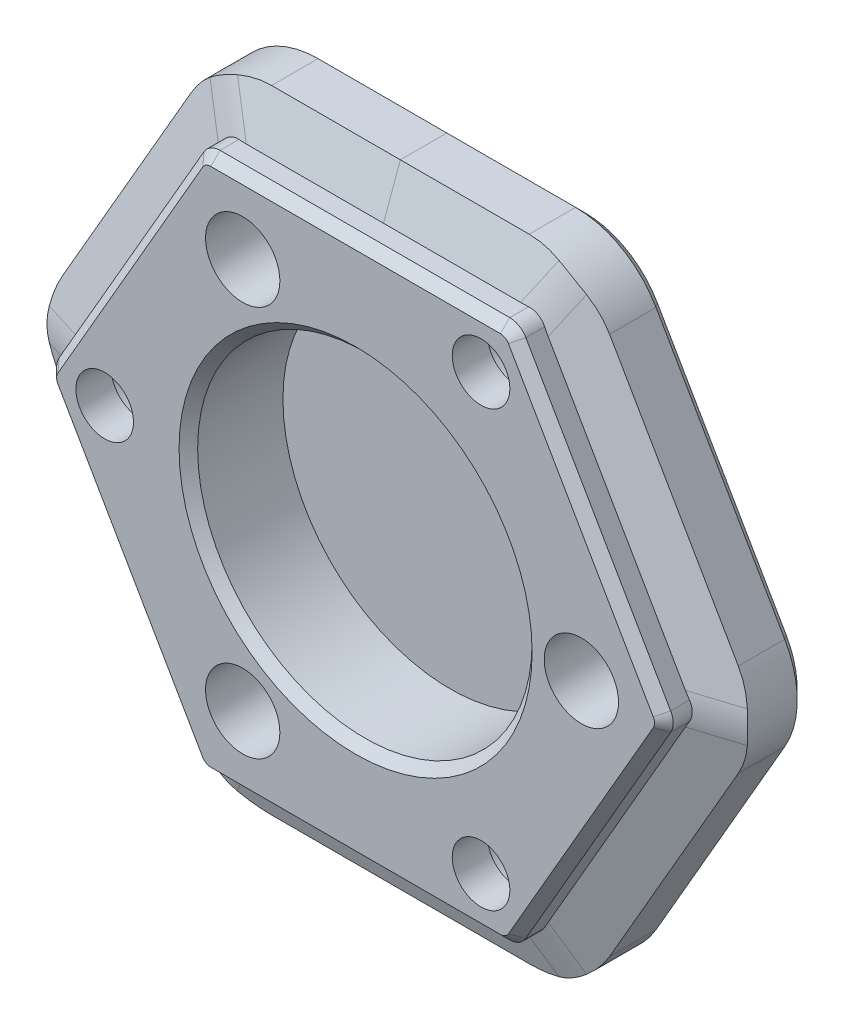
from build123d import *

# Parameters (mm, degrees)
EXTRUDE_1_DEPTH              = 2.5
EXTRUDE_1_DEPTH_BACK         = 5.5
HOLE_WIZARD_M3_1_D           = 3.1
HOLE_WIZARD_M3_1_CBORE_D     = 4.7
HOLE_WIZARD_M3_1_CBORE_DEPTH = 3.1
F_4_0MM_1_D                  = 4
F_4_0MM_1_DEPTH              = 3
F_4_0MM_1_TIP                = 1.2017212380551205
SKETCH_8_R                   = 9
CUT_EXTRUDE_1_DEPTH          = 24.549593060886075
FILLET_1_R                   = 5
FILLET_2_R                   = 1
CHAMFER_1_SIZE               = 0.5
SKETCH_12_W                  = 46.13133583021225
SKETCH_12_H                  = 41.62522244020373
CUT_EXTRUDE_2_DEPTH          = 2.90993
SKETCH_15_R                  = 2.3500000000000005
SKETCH_15_R_2                = 2.35
SKETCH_15_R_3                = 2.3499999999999965
EXTRUDE_2_DEPTH              = 0.31999999999999984
CUT_EXTRUDE_START            = -3
SKETCH_16_R                  = 2.35
SKETCH_16_R_2                = 2.3499999999999983
SKETCH_16_R_3                = 2.350000000000001
CUT_EXTRUDE_3_DEPTH          = 3
CHAMFER_3_SIZE               = 0.5


with BuildPart() as part:
    # 草图2 → 凸台-拉伸1 (new, two sides: drawn at the far end of the back side and taken through both)
    with BuildSketch(Plane.XY.offset(-EXTRUDE_1_DEPTH_BACK)):
        Polygon((8.37157890324957, 14.500000000000002), (-8.371578903249578, 14.5), (-16.743157806499145, -8.65e-15), (-8.371578903249565, -14.500000000000005), (8.37157890324958, -14.500000000000002), (16.743157806499152, 4.1e-15), align=None)
    extrude(amount=EXTRUDE_1_DEPTH + EXTRUDE_1_DEPTH_BACK)

    # M3 六角圆柱头螺钉的柱形沉头孔1 (through all)
    with Locations(Plane(origin=(0, 0, -5.5), x_dir=(-1, 0, 0), z_dir=(0, 0, -1))):
        with Locations((-6.75, 11.691342951), (13.5, 0), (-6.75, -11.691342951)):
            CounterBoreHole(HOLE_WIZARD_M3_1_D / 2, HOLE_WIZARD_M3_1_CBORE_D / 2, HOLE_WIZARD_M3_1_CBORE_DEPTH)

    # Ø4.0mm 暗销孔1
    with Locations(Plane.XY.offset(2.5)):
        with Locations((-6.075, 10.522208656), (12.15, 0), (-6.075, -10.522208656)):
            Hole(F_4_0MM_1_D / 2, depth=F_4_0MM_1_DEPTH)
            with Locations((0, 0, -(F_4_0MM_1_DEPTH + F_4_0MM_1_TIP / 2))):  # 118° drill point
                Cone(0, F_4_0MM_1_D / 2, F_4_0MM_1_TIP, mode=Mode.SUBTRACT)

    # 草图8 → 切除-拉伸1 (cut, through all)
    with BuildSketch(Plane.XY.offset(2.5)):
        Circle(SKETCH_8_R)
    extrude(amount=-CUT_EXTRUDE_1_DEPTH, mode=Mode.SUBTRACT)

    # 扫描1: sweep along a path in 草图10
    with BuildLine(Plane(origin=(0, 0, -2.4999999999999996), x_dir=(-1, 0, 0), z_dir=(0, 0, -1))) as sweep_1_path:
        Line((-16.743157806499152, 4.1e-15), (-8.37157890324958, -14.500000000000002))
        Line((-8.37157890324958, -14.500000000000002), (8.371578903249565, -14.500000000000005))
        Line((8.371578903249565, -14.500000000000005), (16.743157806499145, -8.67e-15))
        Line((16.743157806499145, -8.67e-15), (8.371578903249578, 14.5))
        Line((8.371578903249578, 14.5), (-8.37157890324957, 14.500000000000002))
        Line((-8.37157890324957, 14.500000000000002), (-16.743157806499152, 4.1e-15))
    # 草图11 → 扫描1 (sweep)
    with BuildSketch(Plane(origin=(0, 0, 0), x_dir=(0, 0, -1), z_dir=(1, 0, 0))):
        Polygon((-0.9999999999999983, 14.500000000000002), (-0.09007441433450215, 17), (2.5900744143345036, 17), (3.5000000000000004, 14.500000000000002), align=None)
    sweep(path=sweep_1_path.line, transition=Transition.RIGHT)

    # 圆角1
    # the kernel refuses this fillet: 5 mm, written as the material it takes off along each edge
    with BuildSketch(Plane(origin=(-21.699133757052998, 1.78e-15, -1.9378393637257618), x_dir=(0.051410172730168284, 0.9852692806486317, 0.16309947501442795), z_dir=(0.9537419254229482, 0, -0.3006265784832199))) as fillet_1_piece_1_section:
        with BuildLine():
            CenterArc((FILLET_1_R * 0.173566836013, FILLET_1_R), FILLET_1_R, 250.30689612033188, 19.693103879668)
            Line((-FILLET_1_R * 0.163415104569, FILLET_1_R * 0.0584888892203), (0, 0))
            Line((0, 0), (FILLET_1_R * 0.173566836013, 1e-17))
        make_face()
    fillet_1_piece_1 = extrude(amount=7.365934502715903, mode=Mode.PRIVATE)
    fillet_1_piece_1 = split(fillet_1_piece_1, bisect_by=Plane(origin=(-17.104001724877012, 0.6250000002326955, -2.983935054757399), z_dir=(-0.8660254037844385, -0.5000000000000004, 0)), keep=Keep.TOP, mode=Mode.PRIVATE)
    add(fillet_1_piece_1, mode=Mode.SUBTRACT)
    with BuildSketch(Plane(origin=(-21.699133757052998, 1.78e-15, -1.9378393637257618), x_dir=(0.051410172730168284, 0.9852692806486317, 0.16309947501442795), z_dir=(0.9537419254229482, 0, -0.3006265784832199))) as fillet_1_piece_2_section:
        with BuildLine():
            CenterArc((FILLET_1_R * 0.173566836013, FILLET_1_R), FILLET_1_R, 250.30689612033188, 19.693103879668)
            Line((-FILLET_1_R * 0.163415104569, FILLET_1_R * 0.0584888892203), (0, 0))
            Line((0, 0), (FILLET_1_R * 0.173566836013, 1e-17))
        make_face()
    fillet_1_piece_2 = extrude(amount=7.365934502715903, mode=Mode.PRIVATE)
    fillet_1_piece_2 = split(fillet_1_piece_2, bisect_by=Plane(origin=(-16.594745156928745, 0.2570582495418403, -3.4219081297930405), z_dir=(-0.866025403784439, 0.4999999999999995, 0)), keep=Keep.TOP, mode=Mode.PRIVATE)
    add(fillet_1_piece_2, mode=Mode.SUBTRACT)
    with BuildSketch(Plane(origin=(-14.673933201893433, 4.76e-15, 1.652235050608729), x_dir=(0.05141017273016755, 0.9852692806486321, -0.16309947501442584), z_dir=(-0.9537419254229483, 0, -0.30062657848321955))) as fillet_1_piece_3_section:
        with BuildLine():
            CenterArc((FILLET_1_R * 0.173566836013, FILLET_1_R), FILLET_1_R, 250.30689612033208, 19.693103879667945)
            Line((-FILLET_1_R * 0.163415104569, FILLET_1_R * 0.0584888892203), (0, 0))
            Line((0, 0), (FILLET_1_R * 0.173566836013, -2e-17))
        make_face()
    fillet_1_piece_3 = extrude(amount=7.365934502715857, mode=Mode.PRIVATE)
    fillet_1_piece_3 = split(fillet_1_piece_3, bisect_by=Plane(origin=(-16.594745156928774, -0.2570582495418085, 0.9219081297930433), z_dir=(-0.8660254037844385, -0.5000000000000004, 0)), keep=Keep.TOP, mode=Mode.PRIVATE)
    add(fillet_1_piece_3, mode=Mode.SUBTRACT)
    with BuildSketch(Plane(origin=(-14.673933201893433, 4.76e-15, 1.652235050608729), x_dir=(0.05141017273016755, 0.9852692806486321, -0.16309947501442584), z_dir=(-0.9537419254229483, 0, -0.30062657848321955))) as fillet_1_piece_4_section:
        with BuildLine():
            CenterArc((FILLET_1_R * 0.173566836013, FILLET_1_R), FILLET_1_R, 250.30689612033208, 19.693103879667945)
            Line((-FILLET_1_R * 0.163415104569, FILLET_1_R * 0.0584888892203), (0, 0))
            Line((0, 0), (FILLET_1_R * 0.173566836013, -2e-17))
        make_face()
    fillet_1_piece_4 = extrude(amount=7.365934502715857, mode=Mode.PRIVATE)
    fillet_1_piece_4 = split(fillet_1_piece_4, bisect_by=Plane(origin=(-16.59474515692879, 0.2570582495417568, 0.921908129793047), z_dir=(-0.866025403784439, 0.4999999999999995, 0)), keep=Keep.TOP, mode=Mode.PRIVATE)
    add(fillet_1_piece_4, mode=Mode.SUBTRACT)
    with BuildSketch(Plane(origin=(-19.62990915244726, 4e-15, 7.306952779204819), x_dir=(0.49999999999999994, 0.8660254037844387, 0), z_dir=(-1.4e-16, 0, -1))) as fillet_1_piece_5:
        with BuildLine():
            CenterArc((FILLET_1_R * 0.57735026919, FILLET_1_R), FILLET_1_R, 210.00000000000006, 59.99999999999994)
            Line((-FILLET_1_R * 0.288675134595, FILLET_1_R * 0.5), (0, 0))
            Line((0, 0), (FILLET_1_R * 0.57735026919, -8e-17))
        make_face()
    extrude(amount=17.11390555840964, mode=Mode.SUBTRACT)
    with BuildSketch(Plane(origin=(-10.849566878526495, 18.79200107372437, -1.937839363725764), x_dir=(0.878973312975219, 0.4481121247270444, 0.16309947501442693), z_dir=(0.47687096271147394, -0.8259647360705569, -0.30062657848321983))) as fillet_1_piece_6_section:
        with BuildLine():
            CenterArc((FILLET_1_R * 0.173566836013, FILLET_1_R), FILLET_1_R, 250.306896120332, 19.693103879667945)
            Line((-FILLET_1_R * 0.163415104569, FILLET_1_R * 0.0584888892203), (0, 0))
            Line((0, 0), (FILLET_1_R * 0.173566836013, -2e-17))
        make_face()
    fillet_1_piece_6 = extrude(amount=7.365934502715886, mode=Mode.PRIVATE)
    fillet_1_piece_6 = split(fillet_1_piece_6, bisect_by=Plane(origin=(-8.010734984871702, 15.125000000232719, -2.9839350547573864), z_dir=(-0.866025403784439, 0.4999999999999995, 0)), keep=Keep.TOP, mode=Mode.PRIVATE)
    add(fillet_1_piece_6, mode=Mode.SUBTRACT)
    with BuildSketch(Plane(origin=(-10.849566878526495, 18.79200107372437, -1.937839363725764), x_dir=(0.878973312975219, 0.4481121247270444, 0.16309947501442693), z_dir=(0.47687096271147394, -0.8259647360705569, -0.30062657848321983))) as fillet_1_piece_7_section:
        with BuildLine():
            CenterArc((FILLET_1_R * 0.173566836013, FILLET_1_R), FILLET_1_R, 250.306896120332, 19.693103879667945)
            Line((-FILLET_1_R * 0.163415104569, FILLET_1_R * 0.0584888892203), (0, 0))
            Line((0, 0), (FILLET_1_R * 0.173566836013, -2e-17))
        make_face()
    fillet_1_piece_7 = extrude(amount=7.365934502715886, mode=Mode.PRIVATE)
    fillet_1_piece_7 = split(fillet_1_piece_7, bisect_by=Plane(origin=(-8.07475360410875, 14.5, -3.4219081297930436), z_dir=(-1.1e-16, 1, 0)), keep=Keep.TOP, mode=Mode.PRIVATE)
    add(fillet_1_piece_7, mode=Mode.SUBTRACT)
    with BuildSketch(Plane(origin=(-7.336966600946708, 12.707998926275637, 1.6522350506087344), x_dir=(0.8789733129752186, 0.44811212472704465, -0.16309947501442826), z_dir=(-0.4768709627114745, 0.8259647360705565, -0.3006265784832195))) as fillet_1_piece_8_section:
        with BuildLine():
            CenterArc((FILLET_1_R * 0.173566836013, FILLET_1_R), FILLET_1_R, 250.3068961203319, 19.693103879668)
            Line((-FILLET_1_R * 0.163415104569, FILLET_1_R * 0.0584888892203), (0, 0))
            Line((0, 0), (FILLET_1_R * 0.173566836013, 1e-17))
        make_face()
    fillet_1_piece_8 = extrude(amount=7.3659345027158825, mode=Mode.PRIVATE)
    fillet_1_piece_8 = split(fillet_1_piece_8, bisect_by=Plane(origin=(-8.519991552819953, 14.242941750458193, 0.9219081297930442), z_dir=(-0.866025403784439, 0.4999999999999995, 0)), keep=Keep.TOP, mode=Mode.PRIVATE)
    add(fillet_1_piece_8, mode=Mode.SUBTRACT)
    with BuildSketch(Plane(origin=(-7.336966600946708, 12.707998926275637, 1.6522350506087344), x_dir=(0.8789733129752186, 0.44811212472704465, -0.16309947501442826), z_dir=(-0.4768709627114745, 0.8259647360705565, -0.3006265784832195))) as fillet_1_piece_9_section:
        with BuildLine():
            CenterArc((FILLET_1_R * 0.173566836013, FILLET_1_R), FILLET_1_R, 250.3068961203319, 19.693103879668)
            Line((-FILLET_1_R * 0.163415104569, FILLET_1_R * 0.0584888892203), (0, 0))
            Line((0, 0), (FILLET_1_R * 0.173566836013, 1e-17))
        make_face()
    fillet_1_piece_9 = extrude(amount=7.3659345027158825, mode=Mode.PRIVATE)
    fillet_1_piece_9 = split(fillet_1_piece_9, bisect_by=Plane(origin=(-8.074753604108842, 14.5, 0.9219081297930454), z_dir=(-1.1e-16, 1, 0)), keep=Keep.TOP, mode=Mode.PRIVATE)
    add(fillet_1_piece_9, mode=Mode.SUBTRACT)
    with BuildSketch(Plane(origin=(-9.814954576223633, 17, 7.306952779204824), x_dir=(1, 0, -1.4e-16), z_dir=(-1.4e-16, 0, -1))) as fillet_1_piece_10:
        with BuildLine():
            CenterArc((FILLET_1_R * 0.57735026919, FILLET_1_R), FILLET_1_R, 210.00000000000006, 59.99999999999994)
            Line((-FILLET_1_R * 0.288675134595, FILLET_1_R * 0.5), (0, 0))
            Line((0, 0), (FILLET_1_R * 0.57735026919, 0))
        make_face()
    extrude(amount=17.113905558409648, mode=Mode.SUBTRACT)
    with BuildSketch(Plane(origin=(-10.84956687852649, -18.792001073724368, -1.9378393637257654), x_dir=(-0.8275631402450514, 0.537157155921587, 0.16309947501442554), z_dir=(0.4768709627114741, 0.8259647360705568, -0.3006265784832198))) as fillet_1_piece_11_section:
        with BuildLine():
            CenterArc((FILLET_1_R * 0.173566836013, FILLET_1_R), FILLET_1_R, 250.30689612033206, 19.693103879668)
            Line((-FILLET_1_R * 0.163415104569, FILLET_1_R * 0.0584888892203), (0, 0))
            Line((0, 0), (FILLET_1_R * 0.173566836013, -4e-17))
        make_face()
    fillet_1_piece_11 = extrude(amount=7.365934502715884, mode=Mode.PRIVATE)
    fillet_1_piece_11 = split(fillet_1_piece_11, bisect_by=Plane(origin=(-9.093266740005292, -14.500000000000005, -2.9839350547573957), z_dir=(2.1e-16, -1, 0)), keep=Keep.TOP, mode=Mode.PRIVATE)
    add(fillet_1_piece_11, mode=Mode.SUBTRACT)
    with BuildSketch(Plane(origin=(-10.84956687852649, -18.792001073724368, -1.9378393637257654), x_dir=(-0.8275631402450514, 0.537157155921587, 0.16309947501442554), z_dir=(0.4768709627114741, 0.8259647360705568, -0.3006265784832198))) as fillet_1_piece_12_section:
        with BuildLine():
            CenterArc((FILLET_1_R * 0.173566836013, FILLET_1_R), FILLET_1_R, 250.30689612033206, 19.693103879668)
            Line((-FILLET_1_R * 0.163415104569, FILLET_1_R * 0.0584888892203), (0, 0))
            Line((0, 0), (FILLET_1_R * 0.173566836013, -4e-17))
        make_face()
    fillet_1_piece_12 = extrude(amount=7.365934502715884, mode=Mode.PRIVATE)
    fillet_1_piece_12 = split(fillet_1_piece_12, bisect_by=Plane(origin=(-8.519991552819913, -14.242941750458247, -3.4219081297930494), z_dir=(-0.8660254037844385, -0.5000000000000004, 0)), keep=Keep.TOP, mode=Mode.PRIVATE)
    add(fillet_1_piece_12, mode=Mode.SUBTRACT)
    with BuildSketch(Plane(origin=(-7.336966600946706, -12.70799892627564, 1.6522350506087347), x_dir=(-0.827563140245051, 0.5371571559215875, -0.16309947501442615), z_dir=(-0.4768709627114746, -0.8259647360705565, -0.3006265784832195))) as fillet_1_piece_13_section:
        with BuildLine():
            CenterArc((FILLET_1_R * 0.173566836013, FILLET_1_R), FILLET_1_R, 250.306896120332, 19.693103879668)
            Line((-FILLET_1_R * 0.163415104569, FILLET_1_R * 0.0584888892203), (0, 0))
            Line((0, 0), (FILLET_1_R * 0.173566836013, 1e-17))
        make_face()
    fillet_1_piece_13 = extrude(amount=7.365934502715877, mode=Mode.PRIVATE)
    fillet_1_piece_13 = split(fillet_1_piece_13, bisect_by=Plane(origin=(-8.074753604108817, -14.500000000000005, 0.9219081297930426), z_dir=(2.1e-16, -1, 0)), keep=Keep.TOP, mode=Mode.PRIVATE)
    add(fillet_1_piece_13, mode=Mode.SUBTRACT)
    with BuildSketch(Plane(origin=(-7.336966600946706, -12.70799892627564, 1.6522350506087347), x_dir=(-0.827563140245051, 0.5371571559215875, -0.16309947501442615), z_dir=(-0.4768709627114746, -0.8259647360705565, -0.3006265784832195))) as fillet_1_piece_14_section:
        with BuildLine():
            CenterArc((FILLET_1_R * 0.173566836013, FILLET_1_R), FILLET_1_R, 250.306896120332, 19.693103879668)
            Line((-FILLET_1_R * 0.163415104569, FILLET_1_R * 0.0584888892203), (0, 0))
            Line((0, 0), (FILLET_1_R * 0.173566836013, 1e-17))
        make_face()
    fillet_1_piece_14 = extrude(amount=7.365934502715877, mode=Mode.PRIVATE)
    fillet_1_piece_14 = split(fillet_1_piece_14, bisect_by=Plane(origin=(-8.51999155281996, -14.242941750458167, 0.9219081297930428), z_dir=(-0.8660254037844385, -0.5000000000000004, 0)), keep=Keep.TOP, mode=Mode.PRIVATE)
    add(fillet_1_piece_14, mode=Mode.SUBTRACT)
    with BuildSketch(Plane(origin=(-9.814954576223629, -17, 7.306952779204827), x_dir=(-0.4999999999999998, 0.8660254037844388, 0), z_dir=(-1.4e-16, 0, -1))) as fillet_1_piece_15:
        with BuildLine():
            CenterArc((FILLET_1_R * 0.57735026919, FILLET_1_R), FILLET_1_R, 209.99999999999997, 60)
            Line((-FILLET_1_R * 0.288675134595, FILLET_1_R * 0.5), (0, 0))
            Line((0, 0), (FILLET_1_R * 0.57735026919, 1.1e-16))
        make_face()
    extrude(amount=17.113905558409655, mode=Mode.SUBTRACT)
    with BuildSketch(Plane(origin=(9.814954576223634, 17, 7.306952779204829), x_dir=(-1, 0, -1.4e-16), z_dir=(1.4e-16, 0, -1))) as fillet_1_piece_16:
        with BuildLine():
            CenterArc((FILLET_1_R * 0.57735026919, -FILLET_1_R), FILLET_1_R, 90, 60.00000000000006)
            Line((-FILLET_1_R * 0.288675134595, -FILLET_1_R * 0.5), (0, 0))
            Line((0, 0), (FILLET_1_R * 0.57735026919, 0))
        make_face()
    extrude(amount=17.113905558409662, mode=Mode.SUBTRACT)
    with BuildSketch(Plane(origin=(7.33696660094671, 12.70799892627563, 1.6522350506087367), x_dir=(-0.8789733129752185, 0.44811212472704515, -0.16309947501442718), z_dir=(0.4768709627114746, 0.8259647360705565, -0.3006265784832195))) as fillet_1_piece_17_section:
        with BuildLine():
            CenterArc((FILLET_1_R * 0.173566836013, -FILLET_1_R), FILLET_1_R, 90.00000000000003, 19.69310387966803)
            Line((-FILLET_1_R * 0.163415104569, -FILLET_1_R * 0.0584888892203), (0, 0))
            Line((0, 0), (FILLET_1_R * 0.173566836013, 0))
        make_face()
    fillet_1_piece_17 = extrude(amount=7.365934502715893, mode=Mode.PRIVATE)
    fillet_1_piece_17 = split(fillet_1_piece_17, bisect_by=Plane(origin=(8.519991552819953, 14.242941750458185, 0.9219081297930429), z_dir=(0.8660254037844385, 0.5000000000000004, 0)), keep=Keep.TOP, mode=Mode.PRIVATE)
    add(fillet_1_piece_17, mode=Mode.SUBTRACT)
    with BuildSketch(Plane(origin=(7.33696660094671, 12.70799892627563, 1.6522350506087367), x_dir=(-0.8789733129752185, 0.44811212472704515, -0.16309947501442718), z_dir=(0.4768709627114746, 0.8259647360705565, -0.3006265784832195))) as fillet_1_piece_18_section:
        with BuildLine():
            CenterArc((FILLET_1_R * 0.173566836013, -FILLET_1_R), FILLET_1_R, 90.00000000000003, 19.69310387966803)
            Line((-FILLET_1_R * 0.163415104569, -FILLET_1_R * 0.0584888892203), (0, 0))
            Line((0, 0), (FILLET_1_R * 0.173566836013, 0))
        make_face()
    fillet_1_piece_18 = extrude(amount=7.365934502715893, mode=Mode.PRIVATE)
    fillet_1_piece_18 = split(fillet_1_piece_18, bisect_by=Plane(origin=(8.074753604108826, 14.500000000000002, 0.9219081297930496), z_dir=(-1.1e-16, 1, 0)), keep=Keep.TOP, mode=Mode.PRIVATE)
    add(fillet_1_piece_18, mode=Mode.SUBTRACT)
    with BuildSketch(Plane(origin=(10.849566878526495, 18.792001073724364, -1.9378393637257667), x_dir=(-0.8789733129752189, 0.4481121247270447, 0.163099475014427), z_dir=(-0.4768709627114741, -0.8259647360705568, -0.3006265784832198))) as fillet_1_piece_19_section:
        with BuildLine():
            CenterArc((FILLET_1_R * 0.173566836013, -FILLET_1_R), FILLET_1_R, 90.00000000000003, 19.693103879667987)
            Line((-FILLET_1_R * 0.163415104569, -FILLET_1_R * 0.0584888892203), (0, 0))
            Line((0, 0), (FILLET_1_R * 0.173566836013, 0))
        make_face()
    fillet_1_piece_19 = extrude(amount=7.365934502715872, mode=Mode.PRIVATE)
    fillet_1_piece_19 = split(fillet_1_piece_19, bisect_by=Plane(origin=(8.010734984871721, 15.125000000232674, -2.983935054757385), z_dir=(0.8660254037844385, 0.5000000000000004, 0)), keep=Keep.TOP, mode=Mode.PRIVATE)
    add(fillet_1_piece_19, mode=Mode.SUBTRACT)
    with BuildSketch(Plane(origin=(10.849566878526495, 18.792001073724364, -1.9378393637257667), x_dir=(-0.8789733129752189, 0.4481121247270447, 0.163099475014427), z_dir=(-0.4768709627114741, -0.8259647360705568, -0.3006265784832198))) as fillet_1_piece_20_section:
        with BuildLine():
            CenterArc((FILLET_1_R * 0.173566836013, -FILLET_1_R), FILLET_1_R, 90.00000000000003, 19.693103879667987)
            Line((-FILLET_1_R * 0.163415104569, -FILLET_1_R * 0.0584888892203), (0, 0))
            Line((0, 0), (FILLET_1_R * 0.173566836013, 0))
        make_face()
    fillet_1_piece_20 = extrude(amount=7.365934502715872, mode=Mode.PRIVATE)
    fillet_1_piece_20 = split(fillet_1_piece_20, bisect_by=Plane(origin=(8.074753604108814, 14.500000000000002, -3.4219081297930494), z_dir=(-1.1e-16, 1, 0)), keep=Keep.TOP, mode=Mode.PRIVATE)
    add(fillet_1_piece_20, mode=Mode.SUBTRACT)
    with BuildSketch(Plane(origin=(10.849566878526504, -18.792001073724368, -1.9378393637257634), x_dir=(0.8275631402450517, 0.5371571559215866, 0.16309947501442526), z_dir=(-0.47687096271147383, 0.8259647360705569, -0.30062657848321983))) as fillet_1_piece_21_section:
        with BuildLine():
            CenterArc((FILLET_1_R * 0.173566836013, -FILLET_1_R), FILLET_1_R, 89.99999999999991, 19.693103879668016)
            Line((-FILLET_1_R * 0.163415104569, -FILLET_1_R * 0.0584888892203), (0, 0))
            Line((0, 0), (FILLET_1_R * 0.173566836013, -3e-17))
        make_face()
    fillet_1_piece_21 = extrude(amount=7.365934502715898, mode=Mode.PRIVATE)
    fillet_1_piece_21 = split(fillet_1_piece_21, bisect_by=Plane(origin=(9.093266740005317, -14.500000000000002, -2.983935054757366), z_dir=(2.1e-16, -1, 0)), keep=Keep.TOP, mode=Mode.PRIVATE)
    add(fillet_1_piece_21, mode=Mode.SUBTRACT)
    with BuildSketch(Plane(origin=(10.849566878526504, -18.792001073724368, -1.9378393637257634), x_dir=(0.8275631402450517, 0.5371571559215866, 0.16309947501442526), z_dir=(-0.47687096271147383, 0.8259647360705569, -0.30062657848321983))) as fillet_1_piece_22_section:
        with BuildLine():
            CenterArc((FILLET_1_R * 0.173566836013, -FILLET_1_R), FILLET_1_R, 89.99999999999991, 19.693103879668016)
            Line((-FILLET_1_R * 0.163415104569, -FILLET_1_R * 0.0584888892203), (0, 0))
            Line((0, 0), (FILLET_1_R * 0.173566836013, -3e-17))
        make_face()
    fillet_1_piece_22 = extrude(amount=7.365934502715898, mode=Mode.PRIVATE)
    fillet_1_piece_22 = split(fillet_1_piece_22, bisect_by=Plane(origin=(8.51999155281995, -14.242941750458204, -3.4219081297930467), z_dir=(0.8660254037844388, -0.49999999999999983, 0)), keep=Keep.TOP, mode=Mode.PRIVATE)
    add(fillet_1_piece_22, mode=Mode.SUBTRACT)
    with BuildSketch(Plane(origin=(7.336966600946717, -12.707998926275632, 1.6522350506087355), x_dir=(0.827563140245051, 0.5371571559215874, -0.16309947501442654), z_dir=(0.4768709627114745, -0.8259647360705566, -0.30062657848321955))) as fillet_1_piece_23_section:
        with BuildLine():
            CenterArc((FILLET_1_R * 0.173566836013, -FILLET_1_R), FILLET_1_R, 90.00000000000001, 19.693103879667987)
            Line((-FILLET_1_R * 0.163415104569, -FILLET_1_R * 0.0584888892203), (0, 0))
            Line((0, 0), (FILLET_1_R * 0.173566836013, -1e-17))
        make_face()
    fillet_1_piece_23 = extrude(amount=7.365934502715883, mode=Mode.PRIVATE)
    fillet_1_piece_23 = split(fillet_1_piece_23, bisect_by=Plane(origin=(8.07475360410884, -14.500000000000002, 0.9219081297930415), z_dir=(2.1e-16, -1, 0)), keep=Keep.TOP, mode=Mode.PRIVATE)
    add(fillet_1_piece_23, mode=Mode.SUBTRACT)
    with BuildSketch(Plane(origin=(7.336966600946717, -12.707998926275632, 1.6522350506087355), x_dir=(0.827563140245051, 0.5371571559215874, -0.16309947501442654), z_dir=(0.4768709627114745, -0.8259647360705566, -0.30062657848321955))) as fillet_1_piece_24_section:
        with BuildLine():
            CenterArc((FILLET_1_R * 0.173566836013, -FILLET_1_R), FILLET_1_R, 90.00000000000001, 19.693103879667987)
            Line((-FILLET_1_R * 0.163415104569, -FILLET_1_R * 0.0584888892203), (0, 0))
            Line((0, 0), (FILLET_1_R * 0.173566836013, -1e-17))
        make_face()
    fillet_1_piece_24 = extrude(amount=7.365934502715883, mode=Mode.PRIVATE)
    fillet_1_piece_24 = split(fillet_1_piece_24, bisect_by=Plane(origin=(8.51999155281996, -14.242941750458188, 0.9219081297930419), z_dir=(0.8660254037844388, -0.49999999999999983, 0)), keep=Keep.TOP, mode=Mode.PRIVATE)
    add(fillet_1_piece_24, mode=Mode.SUBTRACT)
    with BuildSketch(Plane(origin=(9.814954576223641, -17, 7.306952779204825), x_dir=(0.4999999999999994, 0.8660254037844392, 0), z_dir=(1.4e-16, 0, -1))) as fillet_1_piece_25:
        with BuildLine():
            CenterArc((FILLET_1_R * 0.57735026919, -FILLET_1_R), FILLET_1_R, 90.00000000000006, 59.99999999999997)
            Line((-FILLET_1_R * 0.288675134595, -FILLET_1_R * 0.5), (0, 0))
            Line((0, 0), (FILLET_1_R * 0.57735026919, -3e-17))
        make_face()
    extrude(amount=17.11390555840965, mode=Mode.SUBTRACT)
    with BuildSketch(Plane(origin=(21.699133757052994, -1.243e-14, -1.9378393637257654), x_dir=(-0.05141017273016782, 0.9852692806486318, 0.163099475014427), z_dir=(-0.9537419254229482, 0, -0.3006265784832199))) as fillet_1_piece_26_section:
        with BuildLine():
            CenterArc((FILLET_1_R * 0.173566836013, -FILLET_1_R), FILLET_1_R, 90.00000000000003, 19.69310387966803)
            Line((-FILLET_1_R * 0.163415104569, -FILLET_1_R * 0.0584888892203), (0, 0))
            Line((0, 0), (FILLET_1_R * 0.173566836013, 0))
        make_face()
    fillet_1_piece_26 = extrude(amount=7.3659345027158825, mode=Mode.PRIVATE)
    fillet_1_piece_26 = split(fillet_1_piece_26, bisect_by=Plane(origin=(17.10400172487704, 0.6250000002327454, -2.9839350547573473), z_dir=(0.8660254037844388, -0.49999999999999983, 0)), keep=Keep.TOP, mode=Mode.PRIVATE)
    add(fillet_1_piece_26, mode=Mode.SUBTRACT)
    with BuildSketch(Plane(origin=(21.699133757052994, -1.243e-14, -1.9378393637257654), x_dir=(-0.05141017273016782, 0.9852692806486318, 0.163099475014427), z_dir=(-0.9537419254229482, 0, -0.3006265784832199))) as fillet_1_piece_27_section:
        with BuildLine():
            CenterArc((FILLET_1_R * 0.173566836013, -FILLET_1_R), FILLET_1_R, 90.00000000000003, 19.69310387966803)
            Line((-FILLET_1_R * 0.163415104569, -FILLET_1_R * 0.0584888892203), (0, 0))
            Line((0, 0), (FILLET_1_R * 0.173566836013, 0))
        make_face()
    fillet_1_piece_27 = extrude(amount=7.3659345027158825, mode=Mode.PRIVATE)
    fillet_1_piece_27 = split(fillet_1_piece_27, bisect_by=Plane(origin=(16.594745156928784, 0.2570582495417947, -3.421908129793042), z_dir=(0.8660254037844385, 0.5000000000000004, 0)), keep=Keep.TOP, mode=Mode.PRIVATE)
    add(fillet_1_piece_27, mode=Mode.SUBTRACT)
    with BuildSketch(Plane(origin=(14.67393320189344, -1.243e-14, 1.6522350506087298), x_dir=(-0.05141017273016762, 0.9852692806486318, -0.16309947501442715), z_dir=(0.9537419254229483, 0, -0.3006265784832195))) as fillet_1_piece_28_section:
        with BuildLine():
            CenterArc((FILLET_1_R * 0.173566836013, -FILLET_1_R), FILLET_1_R, 90.00000000000006, 19.693103879667916)
            Line((-FILLET_1_R * 0.163415104569, -FILLET_1_R * 0.0584888892203), (0, 0))
            Line((0, 0), (FILLET_1_R * 0.173566836013, -1e-17))
        make_face()
    fillet_1_piece_28 = extrude(amount=7.365934502715855, mode=Mode.PRIVATE)
    fillet_1_piece_28 = split(fillet_1_piece_28, bisect_by=Plane(origin=(16.594745156928767, -0.25705824954181544, 0.921908129793048), z_dir=(0.8660254037844388, -0.49999999999999983, 0)), keep=Keep.TOP, mode=Mode.PRIVATE)
    add(fillet_1_piece_28, mode=Mode.SUBTRACT)
    with BuildSketch(Plane(origin=(14.67393320189344, -1.243e-14, 1.6522350506087298), x_dir=(-0.05141017273016762, 0.9852692806486318, -0.16309947501442715), z_dir=(0.9537419254229483, 0, -0.3006265784832195))) as fillet_1_piece_29_section:
        with BuildLine():
            CenterArc((FILLET_1_R * 0.173566836013, -FILLET_1_R), FILLET_1_R, 90.00000000000006, 19.693103879667916)
            Line((-FILLET_1_R * 0.163415104569, -FILLET_1_R * 0.0584888892203), (0, 0))
            Line((0, 0), (FILLET_1_R * 0.173566836013, -1e-17))
        make_face()
    fillet_1_piece_29 = extrude(amount=7.365934502715855, mode=Mode.PRIVATE)
    fillet_1_piece_29 = split(fillet_1_piece_29, bisect_by=Plane(origin=(16.594745156928784, 0.2570582495417947, 0.9219081297930443), z_dir=(0.8660254037844385, 0.5000000000000004, 0)), keep=Keep.TOP, mode=Mode.PRIVATE)
    add(fillet_1_piece_29, mode=Mode.SUBTRACT)
    with BuildSketch(Plane(origin=(19.62990915244727, -7.11e-15, 7.3069527792048214), x_dir=(-0.49999999999999967, 0.8660254037844387, 0), z_dir=(1.4e-16, 0, -1))) as fillet_1_piece_30:
        with BuildLine():
            CenterArc((FILLET_1_R * 0.57735026919, -FILLET_1_R), FILLET_1_R, 90, 59.99999999999994)
            Line((-FILLET_1_R * 0.288675134595, -FILLET_1_R * 0.5), (0, 0))
            Line((0, 0), (FILLET_1_R * 0.57735026919, -1.7e-16))
        make_face()
    extrude(amount=17.113905558409645, mode=Mode.SUBTRACT)

    # 圆角2
    fillet_2_edges = [part.edges().sort_by_distance(p)[0] for p in [
        (-8.371578903249464, -14.500000000000014, 1.710809739734672),
        (8.371578903249471, -14.500000000000014, 1.7108097397346722),
        (16.74315780649937, 5.101e-14, 1.710809739734417),
        (8.371578903249468, 14.500000000000014, 1.7108097397346715),
        (-8.371578903249471, 14.500000000000012, 1.710809739734672),
        (-16.743157806499365, 4.186e-14, 1.7108097397344169),
        (-16.743157806499156, 3.2208e-13, -4.4608097397336675),
        (-8.371578903249464, -14.500000000000014, -4.4608097397335165),
        (8.371578903249471, -14.500000000000014, -4.4608097397335955),
        (16.743157806499163, 3.2845e-13, -4.4608097397336675),
        (8.37157890324986, 14.500000000000012, -4.460809739733454),
        (-8.371578903249864, 14.500000000000012, -4.460809739733454),
    ]]
    fillet(fillet_2_edges, radius=FILLET_2_R)

    # 倒角1
    # the kernel refuses this chamfer: 0.5 mm, written as the material it takes off along each edge
    with BuildSketch(Plane(origin=(-16.454482671904177, -0.500000000000278, 2.5), x_dir=(0.86569797422488, 0.49981095845564877, 0.027495876610586497), z_dir=(0.5000000000000004, -0.8660254037844385, 0))) as chamfer_1_piece_1:
        Polygon((CHAMFER_1_SIZE * 0.999621916911, -CHAMFER_1_SIZE * 0.0274958766106), (-CHAMFER_1_SIZE * 0.0274958766106, -CHAMFER_1_SIZE * 0.999621916911), (0, 0), align=None)
    extrude(amount=15.58845726811947, mode=Mode.SUBTRACT)
    with BuildSketch(Plane(origin=(16.454482671904337, 0.5000000000000054, 2.5), x_dir=(-0.86569797422488, -0.49981095845564877, 0.027495876610586497), z_dir=(-0.5000000000000004, 0.8660254037844385, 0))) as chamfer_1_piece_2:
        Polygon((CHAMFER_1_SIZE * 0.999621916911, -CHAMFER_1_SIZE * 0.0274958766106), (-CHAMFER_1_SIZE * 0.0274958766106, -CHAMFER_1_SIZE * 0.999621916911), (0, 0), align=None)
    extrude(amount=15.588457268119896, mode=Mode.SUBTRACT)
    with BuildSketch(Plane(origin=(7.794228634059945, 14.500000000000002, 2.5), x_dir=(0, 0.027495876610585623, -0.9996219169112968), z_dir=(-1, -1.1e-16, 0))) as chamfer_1_piece_3:
        Polygon((CHAMFER_1_SIZE * 0.999621916911, CHAMFER_1_SIZE * 0.0274958766106), (-CHAMFER_1_SIZE * 0.0274958766106, CHAMFER_1_SIZE * 0.999621916911), (0, 0), align=None)
    extrude(amount=15.588457268120116, mode=Mode.SUBTRACT)
    with BuildSketch(Plane(origin=(-8.660254037844457, 13.999999999999886, 2.5), x_dir=(0.8656979742248807, -0.4998109584556478, 0.027495876610586487), z_dir=(-0.4999999999999995, -0.866025403784439, 0))) as chamfer_1_piece_4:
        Polygon((CHAMFER_1_SIZE * 0.999621916911, -CHAMFER_1_SIZE * 0.0274958766106), (-CHAMFER_1_SIZE * 0.0274958766106, -CHAMFER_1_SIZE * 0.999621916911), (0, 0), align=None)
    extrude(amount=15.588457268119642, mode=Mode.SUBTRACT)
    with BuildSketch(Plane(origin=(-7.794228634060141, -14.500000000000005, 2.5), x_dir=(0, 0.9996219169112968, 0.02749587661058651), z_dir=(1, 2.1e-16, 0))) as chamfer_1_piece_5:
        Polygon((CHAMFER_1_SIZE * 0.999621916911, -CHAMFER_1_SIZE * 0.0274958766106), (-CHAMFER_1_SIZE * 0.0274958766106, -CHAMFER_1_SIZE * 0.999621916911), (0, 0), align=None)
    extrude(amount=15.588457268120099, mode=Mode.SUBTRACT)
    with BuildSketch(Plane(origin=(8.660254037844393, -14.000000000000002, 2.5), x_dir=(-0.8656979742248805, 0.49981095845564816, 0.027495876610586487), z_dir=(0.49999999999999983, 0.8660254037844388, 0))) as chamfer_1_piece_6:
        Polygon((CHAMFER_1_SIZE * 0.999621916911, -CHAMFER_1_SIZE * 0.0274958766106), (-CHAMFER_1_SIZE * 0.0274958766106, -CHAMFER_1_SIZE * 0.999621916911), (0, 0), align=None)
    extrude(amount=15.588457268119905, mode=Mode.SUBTRACT)
    with BuildSketch(Plane(origin=(-15.588457268119456, -1.136e-13, 2.5), x_dir=(-0.8660254037844378, -0.5000000000000014, 2.0961010704922966e-13), z_dir=(0.5000000000000014, -0.8660254037844378, -1.94980891237561e-13))) as chamfer_1_piece_7:
        Polygon((0.9999999999999996 - CHAMFER_1_SIZE, 1.0481e-13), (1.0000000000000013, CHAMFER_1_SIZE), (0.9999999999999996, 0), align=None)
    revolve(axis=Axis((-15.588457268119456, -1.136e-13, 2.5), (-2.7911e-13, 6.4e-14, -1)), revolution_arc=59.999999999999986, mode=Mode.SUBTRACT)
    with BuildSketch(Plane(origin=(-7.79422863406017, 13.499999999999975, 2.5), x_dir=(0, 1, 1.554e-14), z_dir=(1, 0, 1.3618e-13))) as chamfer_1_piece_8:
        Polygon((1 - CHAMFER_1_SIZE, -7.77e-15), (0.9999999999999993, -CHAMFER_1_SIZE), (1, 0), align=None)
    revolve(axis=Axis((-7.79422863406017, 13.499999999999975, 2.5), (-1.3618e-13, -1.576e-14, 1)), revolution_arc=60.000000000000036, mode=Mode.SUBTRACT)
    with BuildSketch(Plane(origin=(7.794228634059945, 13.500000000000004, 2.5), x_dir=(8.9e-16, 1, 1.465e-14), z_dir=(-1, 8.9e-16, 1.3055e-13))) as chamfer_1_piece_9:
        Polygon((1 - CHAMFER_1_SIZE, 7.33e-15), (0.9999999999999998, CHAMFER_1_SIZE), (1, 0), align=None)
    revolve(axis=Axis((7.794228634059945, 13.500000000000004, 2.5), (-1.3055e-13, 1.463e-14, -1)), revolution_arc=59.99999999999988, mode=Mode.SUBTRACT)
    with BuildSketch(Plane(origin=(15.588457268119903, 6.97e-15, 2.5), x_dir=(0.8660254037844378, -0.5000000000000014, 2.0605739337042915e-13), z_dir=(-0.5000000000000014, -0.8660254037844378, -1.8765646295237534e-13))) as chamfer_1_piece_10:
        Polygon((0.9999999999999996 - CHAMFER_1_SIZE, -1.0303e-13), (0.9999999999999996, -CHAMFER_1_SIZE), (0.9999999999999996, 0), align=None)
    revolve(axis=Axis((15.588457268119903, 6.97e-15, 2.5), (-2.7235e-13, -5.944e-14, 1)), revolution_arc=60.000000000000185, mode=Mode.SUBTRACT)
    with BuildSketch(Plane(origin=(7.794228634059955, -13.500000000000002, 2.5), x_dir=(0.8660254037844384, -0.5000000000000006, -1.1146639167236583e-13), z_dir=(0.5000000000000006, 0.8660254037844384, -8.132169490957139e-14))) as chamfer_1_piece_11:
        Polygon((0.9999999999999991 - CHAMFER_1_SIZE, -5.573e-14), (0.999999999999999, CHAMFER_1_SIZE), (0.9999999999999991, 0), align=None)
    revolve(axis=Axis((7.794228634059955, -13.500000000000002, 2.5), (-1.373e-13, -1.463e-14, -1)), revolution_arc=59.99999999999986, mode=Mode.SUBTRACT)
    with BuildSketch(Plane(origin=(-7.794228634060141, -13.499999999999988, 2.5), x_dir=(8.9e-16, -1, 1.243e-14), z_dir=(1, 8.9e-16, 1.283e-13))) as chamfer_1_piece_12:
        Polygon((1 - CHAMFER_1_SIZE, 6.22e-15), (0.9999999999999991, CHAMFER_1_SIZE), (1, 0), align=None)
    revolve(axis=Axis((-7.794228634060141, -13.499999999999988, 2.5), (1.283e-13, -1.238e-14, -1)), revolution_arc=60.000000000000036, mode=Mode.SUBTRACT)
    with BuildSketch(Plane(origin=(-8.660254037844478, 13.999999999999847, -5.5), x_dir=(0.865697974224881, -0.49981095845564805, -0.02749587661056788), z_dir=(-0.4999999999999995, -0.866025403784439, 0))) as chamfer_1_piece_13:
        Polygon((CHAMFER_1_SIZE * 0.999621916911, CHAMFER_1_SIZE * 0.0274958766106), (-CHAMFER_1_SIZE * 0.0274958766119, CHAMFER_1_SIZE * 0.999621916911), (0, 0), align=None)
    extrude(amount=15.588457268117134, mode=Mode.SUBTRACT)
    with BuildSketch(Plane(origin=(-16.454482671906703, -0.49999999999589834, -5.5), x_dir=(0.86569797422488, 0.49981095845564877, -0.027495876610585633), z_dir=(0.5000000000000004, -0.8660254037844385, 0))) as chamfer_1_piece_14:
        Polygon((CHAMFER_1_SIZE * 0.999621916911, CHAMFER_1_SIZE * 0.0274958766106), (-CHAMFER_1_SIZE * 0.0274958766106, CHAMFER_1_SIZE * 0.999621916911), (0, 0), align=None)
    extrude(amount=15.588457268124642, mode=Mode.SUBTRACT)
    with BuildSketch(Plane(origin=(16.454482671904614, 0.4999999999995269, -5.5), x_dir=(-0.86569797422488, -0.49981095845564877, -0.027495876610585633), z_dir=(-0.5000000000000004, 0.8660254037844385, 0))) as chamfer_1_piece_15:
        Polygon((CHAMFER_1_SIZE * 0.999621916911, CHAMFER_1_SIZE * 0.0274958766106), (-CHAMFER_1_SIZE * 0.0274958766106, CHAMFER_1_SIZE * 0.999621916911), (0, 0), align=None)
    extrude(amount=15.588457268120722, mode=Mode.SUBTRACT)
    with BuildSketch(Plane(origin=(8.660254037844457, -13.999999999999892, -5.5), x_dir=(-0.8656979742248805, 0.49981095845564816, -0.027495876610585623), z_dir=(0.49999999999999983, 0.8660254037844388, 0))) as chamfer_1_piece_16:
        Polygon((CHAMFER_1_SIZE * 0.999621916911, CHAMFER_1_SIZE * 0.0274958766106), (-CHAMFER_1_SIZE * 0.0274958766106, CHAMFER_1_SIZE * 0.999621916911), (0, 0), align=None)
    extrude(amount=15.588457268119205, mode=Mode.SUBTRACT)
    with BuildSketch(Plane(origin=(-7.794228634059938, -14.500000000000005, -5.5), x_dir=(0, 0.9996219169112968, -0.027495876610585647), z_dir=(1, 2.1e-16, 0)), Plane(origin=(7.794228634059366, 14.500000000000002, -5.5), x_dir=(0, -0.9996219169112968, -0.027495876610585647), z_dir=(-1, -1.1e-16, 0))) as chamfer_1_piece_17:
        Polygon((CHAMFER_1_SIZE * 0.999621916911, CHAMFER_1_SIZE * 0.0274958766106), (-CHAMFER_1_SIZE * 0.0274958766106, CHAMFER_1_SIZE * 0.999621916911), (0, 0), align=None)
    extrude(amount=15.58845726812011, mode=Mode.SUBTRACT)
    with BuildSketch(Plane(origin=(-7.794228634060743, 13.5, -5.5), x_dir=(0, 1, -1.155e-14), z_dir=(1, 0, 2.7521e-13))) as chamfer_1_piece_18:
        Polygon((1 - CHAMFER_1_SIZE, 5.77e-15), (0.9999999999999996, CHAMFER_1_SIZE), (1, 0), align=None)
    revolve(axis=Axis((-7.794228634060743, 13.5, -5.5), (-2.7521e-13, 1.197e-14, 1)), revolution_arc=59.999999999987466, mode=Mode.SUBTRACT)
    with BuildSketch(Plane(origin=(7.794228634059366, 13.499999999999982, -5.5), x_dir=(8.9e-16, 1, -1.066e-14), z_dir=(-1, 8.9e-16, 2.7863e-13))) as chamfer_1_piece_19:
        Polygon((1 - CHAMFER_1_SIZE, -5.33e-15), (1, -CHAMFER_1_SIZE), (1, 0), align=None)
    revolve(axis=Axis((7.794228634059366, 13.499999999999982, -5.5), (-2.7863e-13, -1.026e-14, -1)), revolution_arc=59.99999999999988, mode=Mode.SUBTRACT)
    with BuildSketch(Plane(origin=(15.588457268119885, -6.4174e-13, -5.5), x_dir=(0.8660254037844378, -0.5000000000000014, 1.48325796089921e-13), z_dir=(-0.5000000000000014, -0.8660254037844378, 2.745812337994632e-13))) as chamfer_1_piece_20:
        Polygon((0.9999999999999996 - CHAMFER_1_SIZE, -7.416e-14), (1.0000000000000002, CHAMFER_1_SIZE), (0.9999999999999996, 0), align=None)
    revolve(axis=Axis((15.588457268119885, -6.4174e-13, -5.5), (8.55e-15, 3.1212e-13, 1)), revolution_arc=60.000000000000135, mode=Mode.SUBTRACT)
    with BuildSketch(Plane(origin=(7.79422863406017, -13.499999999999979, -5.5), x_dir=(0, -1, -1.155e-14), z_dir=(-1, 0, -1.0342e-13))) as chamfer_1_piece_21:
        Polygon((1 - CHAMFER_1_SIZE, 5.77e-15), (0.9999999999999996, CHAMFER_1_SIZE), (1, 0), align=None)
    revolve(axis=Axis((7.79422863406017, -13.499999999999979, -5.5), (-1.0342e-13, -1.111e-14, 1)), revolution_arc=59.99999999999993, mode=Mode.SUBTRACT)
    with BuildSketch(Plane(origin=(-7.794228634059938, -13.500000000000007, -5.5), x_dir=(8.9e-16, -1, -9.77e-15), z_dir=(1, 8.9e-16, -9.658e-14))) as chamfer_1_piece_22:
        Polygon((1 - CHAMFER_1_SIZE, -4.88e-15), (1.0000000000000004, -CHAMFER_1_SIZE), (1, 0), align=None)
    revolve(axis=Axis((-7.794228634059938, -13.500000000000007, -5.5), (-9.658e-14, 9.4e-15, -1)), revolution_arc=60.000000000000085, mode=Mode.SUBTRACT)
    with BuildSketch(Plane(origin=(-15.588457268122268, 4.1015e-12, -5.5), x_dir=(-0.8660254037844383, -0.5000000000000006, 1.5187850976872124e-13), z_dir=(0.5000000000000006, -0.8660254037844383, 2.7989261495323486e-13))) as chamfer_1_piece_23:
        Polygon((1.000000000000001 - CHAMFER_1_SIZE, 7.594e-14), (0.9999999999999991, -CHAMFER_1_SIZE), (1.000000000000001, 0), align=None)
    revolve(axis=Axis((-15.588457268122268, 4.1015e-12, -5.5), (8.55e-15, -3.1826e-13, -1)), revolution_arc=60.000000000012754, mode=Mode.SUBTRACT)
    with BuildSketch(Plane(origin=(0, 0, -5.5), x_dir=(1, 0, 0), z_dir=(0, -1, 0))) as chamfer_1_piece_24:
        Polygon((9, CHAMFER_1_SIZE), (9 + CHAMFER_1_SIZE, 0), (9, 0), align=None)
    revolve(axis=Axis((0, 0, -5.5), (0, 0, 1)), mode=Mode.SUBTRACT)
    with BuildSketch(Plane(origin=(0, 0, 2.5), x_dir=(1, 0, 0), z_dir=(0, -1, 0))) as chamfer_1_piece_25:
        Polygon((9 + CHAMFER_1_SIZE, 0), (9, -CHAMFER_1_SIZE), (9, 0), align=None)
    revolve(axis=Axis((0, 0, 2.5), (0, 0, 1)), mode=Mode.SUBTRACT)

    # 草图12 → 切除-拉伸2 (cut)
    with BuildSketch(Plane(origin=(0, 0, -5.5), x_dir=(-1, 0, 0), z_dir=(0, 0, -1))):
        with Locations((0.8730594693141445, 0.4787745476884293)):
            Rectangle(SKETCH_12_W, SKETCH_12_H)
    extrude(amount=-CUT_EXTRUDE_2_DEPTH, mode=Mode.SUBTRACT)


with BuildPart() as extrude_2_tool:
    # 草图15 → 凸台-拉伸2 (new body)
    with BuildSketch(Plane(origin=(-11.25833024919772, 14.499999999999998, -2.5900744143345036), x_dir=(-1, 0, 0), z_dir=(0, 0, -1))):
        with BuildLine():
            Line((-1.735e-14, -29.000000000000018), (6.928203230275501, -17.000000000000007))
            ThreePointArc((6.928203230275501, -17.000000000000007), (7.598076211353309, -14.500000000000007), (6.928203230275503, -12.000000000000005))
            Line((6.928203230275503, -12.000000000000005), (0, 0))
            ThreePointArc((0, 0), (-1.8301270189221936, 1.8301270189221959), (-4.330127018922194, 2.500000000000002))
            Line((-4.330127018922194, 2.500000000000002), (-11.25833024919772, 2.500000000000002))
            Line((-11.25833024919772, 2.500000000000002), (-18.186533479473244, 2.500000000000002))
            ThreePointArc((-18.186533479473244, 2.500000000000002), (-20.686533479473244, 1.8301270189221959), (-22.51666049839544, 3.47e-15))
            Line((-22.51666049839544, 3.47e-15), (-29.44486372867095, -11.999999999999991))
            ThreePointArc((-29.44486372867095, -11.999999999999991), (-30.114736709748755, -14.499999999999988), (-29.44486372867095, -16.99999999999999))
            Line((-29.44486372867095, -16.99999999999999), (-22.51666049839543, -29.00000000000001))
            ThreePointArc((-22.51666049839543, -29.00000000000001), (-20.686533479473237, -30.830127018922205), (-18.186533479473237, -31.500000000000014))
            Line((-18.186533479473237, -31.500000000000014), (-4.330127018922218, -31.500000000000014))
            ThreePointArc((-4.330127018922218, -31.500000000000014), (-1.8301270189222167, -30.83012701892221), (-1.735e-14, -29.000000000000018))
        make_face()
        with Locations((-18.008330249197666, -26.191342951089958)):
            Circle(SKETCH_15_R, mode=Mode.SUBTRACT)
        with Locations((2.2416697508022847, -14.499999999999927)):
            Circle(SKETCH_15_R_2, mode=Mode.SUBTRACT)
        with Locations((-18.008330249197776, -2.808657048910106)):
            Circle(SKETCH_15_R_3, mode=Mode.SUBTRACT)
    extrude(amount=EXTRUDE_2_DEPTH)


with BuildPart() as part_1:
    add(part.part)


with BuildPart() as part_2:
    # 凸台-拉伸2: joined with extrude_2_tool
    add(part_1.part.fuse(extrude_2_tool.part, tol=0.00001))

    # 草图16 → 切除-拉伸3 (cut)
    with BuildSketch(Plane(origin=(0, 0, -2.3999999999999995), x_dir=(-1, 0, 0), z_dir=(0, 0, -1)).offset(CUT_EXTRUDE_START)):
        with Locations((-6.749999999999945, -11.691342951089956)):
            Circle(SKETCH_16_R)
        with Locations((13.500000000000004, 7.041e-14)):
            Circle(SKETCH_16_R_2)
        with Locations((-6.750000000000059, 11.691342951089894)):
            Circle(SKETCH_16_R_3)
    extrude(amount=CUT_EXTRUDE_3_DEPTH, mode=Mode.SUBTRACT)

    # 倒角3
    chamfer_3_edges = [part_2.edges().sort_by_distance(p)[0] for p in [
        (-9.428203230275503, -16.330127018922212, -2.9100744143345034),
        (-14.722431864335462, -8.500000000000016, -2.9100744143345034),
        (-18.856406460551028, -8.88e-15, -2.9100744143345034),
        (-14.722431864335471, 8.499999999999996, -2.9100744143345034),
        (-9.428203230275527, 16.330127018922195, -2.9100744143345034),
        (0, 17, -2.9100744143345034),
        (9.428203230275525, 16.330127018922195, -2.9100744143345034),
        (14.722431864335476, 8.500000000000004, -2.9100744143345034),
        (18.856406460551035, 8.88e-15, -2.9100744143345034),
        (14.72243186433547, -8.500000000000002, -2.9100744143345034),
        (9.428203230275518, -16.330127018922205, -2.9100744143345034),
        (7.11e-15, -17.000000000000014, -2.9100744143345034),
    ]]
    chamfer(chamfer_3_edges, length=CHAMFER_3_SIZE)


solid = part_2.part
